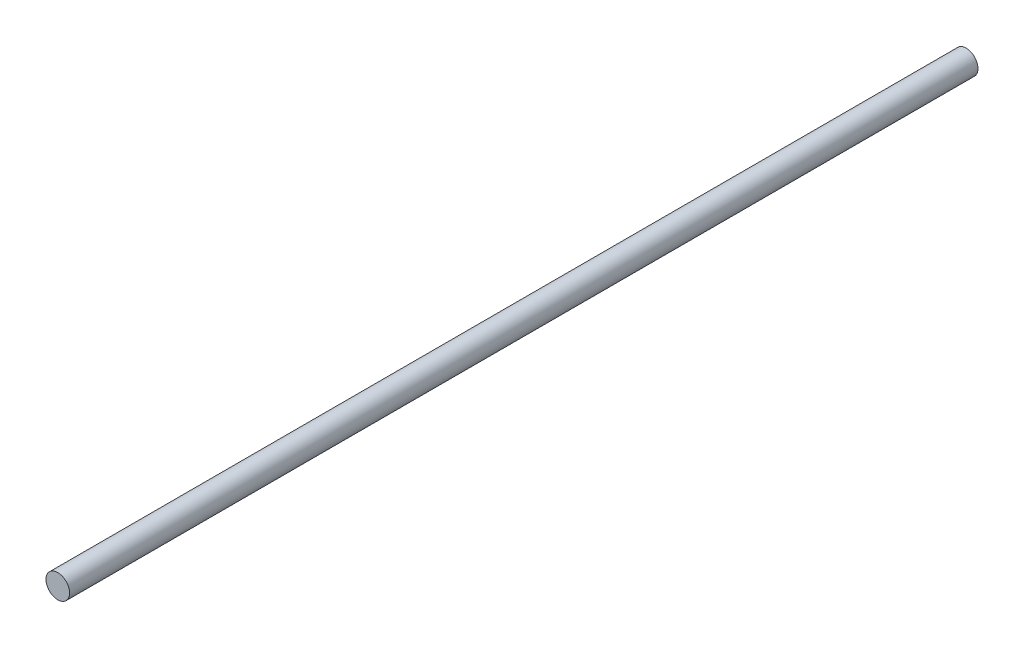
from build123d import *

# Parameters (mm, degrees)
BOSS_EXTRUDE1_DEPTH      = 190.5
BOSS_EXTRUDE1_DEPTH_BACK = 190.5
SKETCH1_R                = 4.953


with BuildPart() as part:
    # Sketch1 → Boss-Extrude1 (new, two sides: drawn at the far end of the back side and taken through both)
    with BuildSketch(Plane.XY.offset(-BOSS_EXTRUDE1_DEPTH_BACK)):
        Circle(SKETCH1_R)
    extrude(amount=BOSS_EXTRUDE1_DEPTH + BOSS_EXTRUDE1_DEPTH_BACK)


solid = part.part
